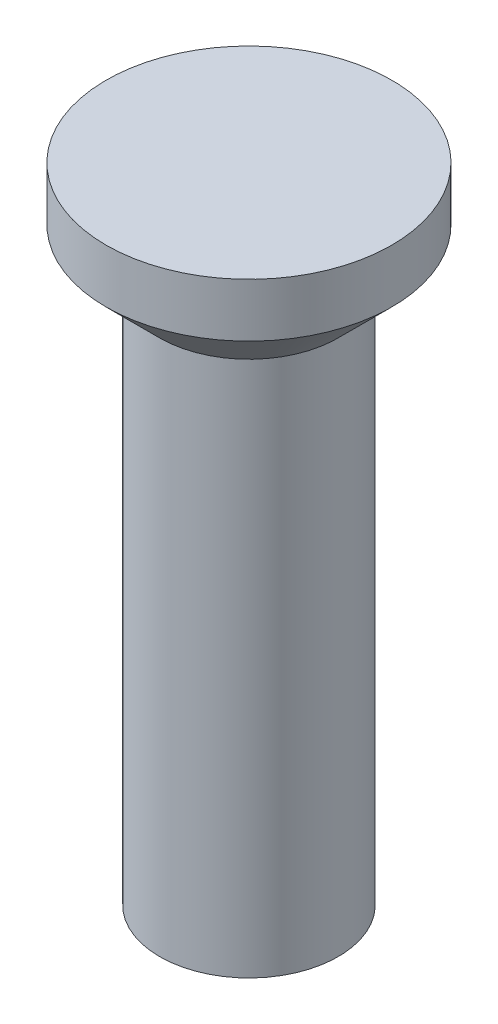
from build123d import *


with BuildPart() as part:
    # Эскиз1 → Повернуть1 (revolve)
    with BuildSketch(Plane.XY):
        Polygon((0, 0), (25, 0), (25, 150), (40, 165), (40, 180), (0, 180), align=None)
    revolve(axis=Axis((0, 348.080420571, 0), (0, -1, 0)))


solid = part.part
